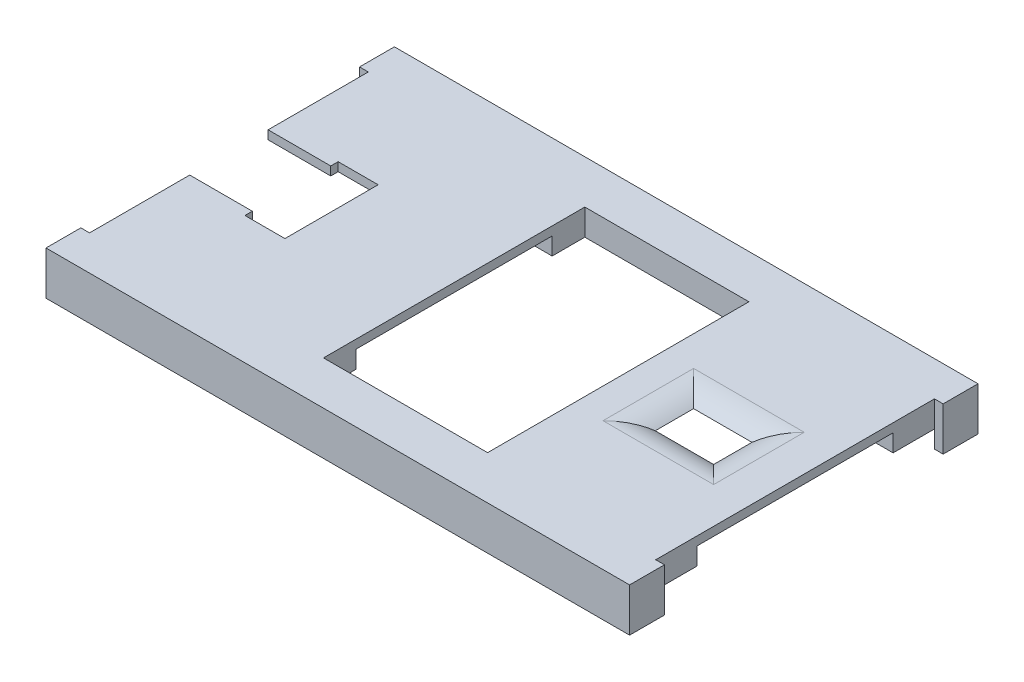
from build123d import *

# Parameters (mm, degrees)
BOSS_EXTRUDE1_DEPTH     = 3
SKETCH2_W               = 6.7
SKETCH2_H               = 4.4
SKETCH2_W_2             = 18.84
SKETCH2_H_2             = 30
CUT_EXTRUDE1_DEPTH      = 77.380625816
CUT_EXTRUDE2_DEPTH      = 61.059054272
CUT_EXTRUDE2_DEPTH_BACK = 61.059054272
SKETCH5_W               = 22.5
SKETCH5_H               = 2
FILLET3_R               = 5
BOSS_EXTRUDE2_DEPTH     = 5


with BuildPart() as part:
    # Sketch1 → Boss-Extrude1 (new body)
    with BuildSketch(Plane(origin=(0, 0, 0), x_dir=(1, 0, 0), z_dir=(0, 1, 0))):
        Polygon((65, -38), (65, -40), (63, -40), (2, -40), (0, -40), (0, -38), (0, -2), (0, 0), (2, 0), (63, 0), (65, 0), (65, -2), align=None)
    extrude(amount=BOSS_EXTRUDE1_DEPTH)

    # Sketch2 → Cut-Extrude1 (cut, through all)
    with BuildSketch(Plane(origin=(0, 3, 0), x_dir=(1, 0, 0), z_dir=(0, 1, 0))):
        with Locations((54.5, -20)):
            Rectangle(SKETCH2_W, SKETCH2_H)
        Polygon((11.78, -25.35), (7.19, -25.35), (7.19, -24.5), (-0.16, -24.5), (-0.16, -15.5), (7.19, -15.5), (7.19, -14.65), (11.78, -14.65), align=None)
        with Locations((35.28, -20)):
            Rectangle(SKETCH2_W_2, SKETCH2_H_2)
    extrude(amount=-CUT_EXTRUDE1_DEPTH, mode=Mode.SUBTRACT)

    # Sketch5 → Cut-Extrude2 (cut, two sides: drawn at the far end of the back side and taken through both)
    with BuildSketch(Plane.ZY.offset(-44.7).offset(-CUT_EXTRUDE2_DEPTH_BACK)):
        with Locations((20, 1)):
            Rectangle(SKETCH5_W, SKETCH5_H)
    extrude(amount=CUT_EXTRUDE2_DEPTH + CUT_EXTRUDE2_DEPTH_BACK, mode=Mode.SUBTRACT)

    # Fillet3
    # the kernel refuses this fillet: 5 mm, written as the material it takes off along each edge
    with BuildSketch(Plane(origin=(57.85, 3, 22.2), x_dir=(0, 0, 1), z_dir=(-1, 0, 0)), Plane(origin=(51.15, 3, 17.8), x_dir=(0, 0, -1), z_dir=(1, 0, 0))) as fillet3_piece_1:
        with BuildLine():
            CenterArc((3, -5), FILLET3_R, 90, 36.869897646)
            Line((0, -1), (-0.06, -0.92))
            ThreePointArc((-0.06, -0.92), (-0.1, -0.5), (-0.1, 0))
            Line((-0.1, 0), (0, 0.1))
            Line((0, 0.1), (3, 0.1))
            Line((3, 0.1), (3, 0))
        make_face()
    extrude(amount=6.7, mode=Mode.SUBTRACT)
    with BuildSketch(Plane(origin=(57.85, 3, 17.8), x_dir=(1, 0, 0), z_dir=(0, 0, 1)), Plane(origin=(51.15, 3, 22.2), x_dir=(-1, 0, 0), z_dir=(0, 0, -1))) as fillet3_piece_2:
        with BuildLine():
            CenterArc((3, -5), FILLET3_R, 90, 36.869897646)
            Line((0, -1), (-0.06, -0.92))
            ThreePointArc((-0.06, -0.92), (-0.1, -0.5), (-0.1, 0))
            Line((-0.1, 0), (0, 0.1))
            Line((0, 0.1), (3, 0.1))
            Line((3, 0.1), (3, 0))
        make_face()
    extrude(amount=4.4, mode=Mode.SUBTRACT)
    with BuildSketch(Plane(origin=(57.85, 3, 17.8), x_dir=(1, 0, 0), z_dir=(0, 0, 1))) as fillet3_piece_3a_section:
        with BuildLine():
            CenterArc((3, -5), FILLET3_R, 90, 36.869897646)
            Line((0, -1), (-0.06, -0.92))
            ThreePointArc((-0.06, -0.92), (-0.1, -0.5), (-0.1, 0))
            Line((-0.1, 0), (0, 0.1))
            Line((0, 0.1), (3, 0.1))
            Line((3, 0.1), (3, 0))
        make_face()
    fillet3_piece_3a = extrude(amount=11.9, mode=Mode.PRIVATE)
    fillet3_piece_3a = split(fillet3_piece_3a, bisect_by=Plane(origin=(58.699672813, 2.773811602, 22.2), z_dir=(0, 0, 1)), keep=Keep.TOP, mode=Mode.PRIVATE)
    with BuildSketch(Plane(origin=(65.35, 3, 22.2), x_dir=(0, 0, 1), z_dir=(-1, 0, 0))) as fillet3_piece_3b_section:
        with BuildLine():
            CenterArc((3, -5), FILLET3_R, 90, 36.869897646)
            Line((0, -1), (-0.06, -0.92))
            ThreePointArc((-0.06, -0.92), (-0.1, -0.5), (-0.1, 0))
            Line((-0.1, 0), (0, 0.1))
            Line((0, 0.1), (3, 0.1))
            Line((3, 0.1), (3, 0))
        make_face()
    fillet3_piece_3b = extrude(amount=14.2, mode=Mode.PRIVATE)
    fillet3_piece_3b = split(fillet3_piece_3b, bisect_by=Plane(origin=(57.85, 2.773811602, 23.049672813), z_dir=(1, 0, 0)), keep=Keep.TOP, mode=Mode.PRIVATE)
    fillet3_piece_3 = fillet3_piece_3a & fillet3_piece_3b
    add(fillet3_piece_3, mode=Mode.SUBTRACT)
    with BuildSketch(Plane(origin=(57.85, 3, 22.2), x_dir=(0, 0, 1), z_dir=(-1, 0, 0))) as fillet3_piece_4a_section:
        with BuildLine():
            CenterArc((3, -5), FILLET3_R, 90, 36.869897646)
            Line((0, -1), (-0.06, -0.92))
            ThreePointArc((-0.06, -0.92), (-0.1, -0.5), (-0.1, 0))
            Line((-0.1, 0), (0, 0.1))
            Line((0, 0.1), (3, 0.1))
            Line((3, 0.1), (3, 0))
        make_face()
    fillet3_piece_4a = extrude(amount=14.2, mode=Mode.PRIVATE)
    fillet3_piece_4a = split(fillet3_piece_4a, bisect_by=Plane(origin=(51.15, 2.773811602, 23.049672813), z_dir=(-1, 0, 0)), keep=Keep.TOP, mode=Mode.PRIVATE)
    with BuildSketch(Plane(origin=(51.15, 3, 29.7), x_dir=(-1, 0, 0), z_dir=(0, 0, -1))) as fillet3_piece_4b_section:
        with BuildLine():
            CenterArc((3, -5), FILLET3_R, 90, 36.869897646)
            Line((0, -1), (-0.06, -0.92))
            ThreePointArc((-0.06, -0.92), (-0.1, -0.5), (-0.1, 0))
            Line((-0.1, 0), (0, 0.1))
            Line((0, 0.1), (3, 0.1))
            Line((3, 0.1), (3, 0))
        make_face()
    fillet3_piece_4b = extrude(amount=11.9, mode=Mode.PRIVATE)
    fillet3_piece_4b = split(fillet3_piece_4b, bisect_by=Plane(origin=(50.300327187, 2.773811602, 22.2), z_dir=(0, 0, 1)), keep=Keep.TOP, mode=Mode.PRIVATE)
    fillet3_piece_4 = fillet3_piece_4a & fillet3_piece_4b
    add(fillet3_piece_4, mode=Mode.SUBTRACT)
    with BuildSketch(Plane(origin=(51.15, 3, 17.8), x_dir=(0, 0, -1), z_dir=(1, 0, 0))) as fillet3_piece_5a_section:
        with BuildLine():
            CenterArc((3, -5), FILLET3_R, 90, 36.869897646)
            Line((0, -1), (-0.06, -0.92))
            ThreePointArc((-0.06, -0.92), (-0.1, -0.5), (-0.1, 0))
            Line((-0.1, 0), (0, 0.1))
            Line((0, 0.1), (3, 0.1))
            Line((3, 0.1), (3, 0))
        make_face()
    fillet3_piece_5a = extrude(amount=14.2, mode=Mode.PRIVATE)
    fillet3_piece_5a = split(fillet3_piece_5a, bisect_by=Plane(origin=(57.85, 2.773811602, 16.950327187), z_dir=(1, 0, 0)), keep=Keep.TOP, mode=Mode.PRIVATE)
    with BuildSketch(Plane(origin=(57.85, 3, 10.3), x_dir=(1, 0, 0), z_dir=(0, 0, 1))) as fillet3_piece_5b_section:
        with BuildLine():
            CenterArc((3, -5), FILLET3_R, 90, 36.869897646)
            Line((0, -1), (-0.06, -0.92))
            ThreePointArc((-0.06, -0.92), (-0.1, -0.5), (-0.1, 0))
            Line((-0.1, 0), (0, 0.1))
            Line((0, 0.1), (3, 0.1))
            Line((3, 0.1), (3, 0))
        make_face()
    fillet3_piece_5b = extrude(amount=11.9, mode=Mode.PRIVATE)
    fillet3_piece_5b = split(fillet3_piece_5b, bisect_by=Plane(origin=(58.699672813, 2.773811602, 17.8), z_dir=(0, 0, -1)), keep=Keep.TOP, mode=Mode.PRIVATE)
    fillet3_piece_5 = fillet3_piece_5a & fillet3_piece_5b
    add(fillet3_piece_5, mode=Mode.SUBTRACT)
    with BuildSketch(Plane(origin=(43.65, 3, 17.8), x_dir=(0, 0, -1), z_dir=(1, 0, 0))) as fillet3_piece_6a_section:
        with BuildLine():
            CenterArc((3, -5), FILLET3_R, 90, 36.869897646)
            Line((0, -1), (-0.06, -0.92))
            ThreePointArc((-0.06, -0.92), (-0.1, -0.5), (-0.1, 0))
            Line((-0.1, 0), (0, 0.1))
            Line((0, 0.1), (3, 0.1))
            Line((3, 0.1), (3, 0))
        make_face()
    fillet3_piece_6a = extrude(amount=14.2, mode=Mode.PRIVATE)
    fillet3_piece_6a = split(fillet3_piece_6a, bisect_by=Plane(origin=(51.15, 2.773811602, 16.950327187), z_dir=(-1, 0, 0)), keep=Keep.TOP, mode=Mode.PRIVATE)
    with BuildSketch(Plane(origin=(51.15, 3, 22.2), x_dir=(-1, 0, 0), z_dir=(0, 0, -1))) as fillet3_piece_6b_section:
        with BuildLine():
            CenterArc((3, -5), FILLET3_R, 90, 36.869897646)
            Line((0, -1), (-0.06, -0.92))
            ThreePointArc((-0.06, -0.92), (-0.1, -0.5), (-0.1, 0))
            Line((-0.1, 0), (0, 0.1))
            Line((0, 0.1), (3, 0.1))
            Line((3, 0.1), (3, 0))
        make_face()
    fillet3_piece_6b = extrude(amount=11.9, mode=Mode.PRIVATE)
    fillet3_piece_6b = split(fillet3_piece_6b, bisect_by=Plane(origin=(50.300327187, 2.773811602, 17.8), z_dir=(0, 0, -1)), keep=Keep.TOP, mode=Mode.PRIVATE)
    fillet3_piece_6 = fillet3_piece_6a & fillet3_piece_6b
    add(fillet3_piece_6, mode=Mode.SUBTRACT)

    # Sketch8 → Boss-Extrude2 (add)
    with BuildSketch(Plane(origin=(0, 3, 0), x_dir=(1, 0, 0), z_dir=(0, 1, 0))):
        Polygon((-1, -40), (66, -40), (66, -39), (66, -36), (65, -36), (65, -39), (0, -39), (0, -36), (-1, -36), (-1, -39), align=None)
        Polygon((-1, 0), (66, 0), (66, -1), (66, -4), (65, -4), (65, -1), (0, -1), (0, -4), (-1, -4), (-1, -1), align=None)
    extrude(amount=-BOSS_EXTRUDE2_DEPTH)


solid = part.part
